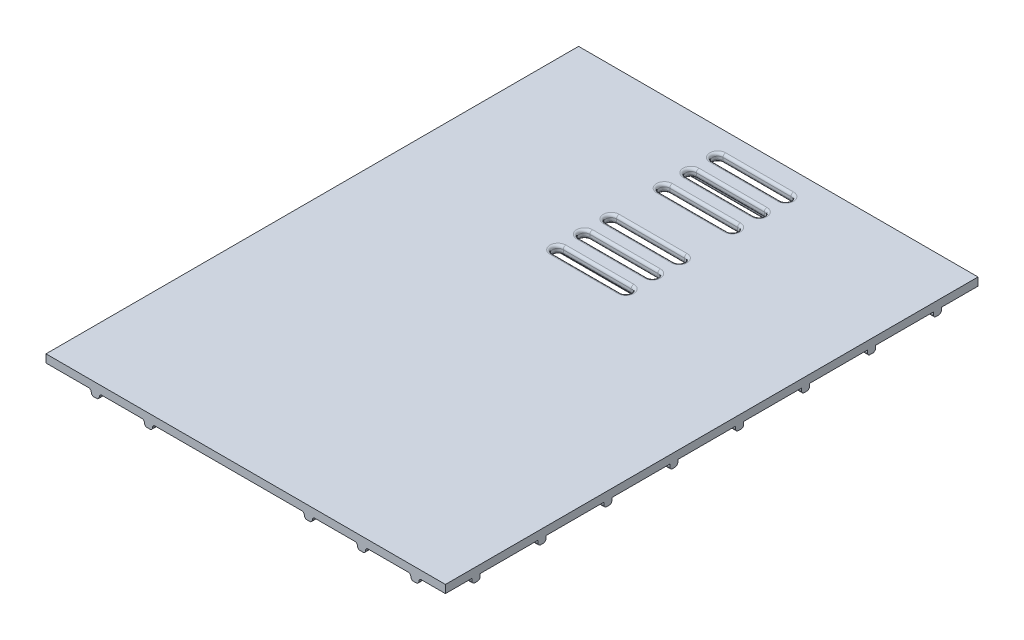
from build123d import *

# Parameters (mm, degrees)
SKETCH1_W              = 150
SKETCH1_H              = 200
BOSS_EXTRUDE1_DEPTH    = 3
BATTERYSTRAP_DEPTH     = 10
FILLET4_R              = 1
LPATTERN1_COUNT        = 3
LPATTERN1_PITCH        = 10
FILLET4_OF_LPATTERN1_R = 1
SKETCH14_W             = 3
SKETCH14_H             = 200
BOSS_EXTRUDE2_DEPTH    = 2
FILLET5_R              = 1
LPATTERN2_COUNT        = 7
LPATTERN2_PITCH        = 20
FILLET5_OF_LPATTERN2_R = 1
SKETCH15_W             = 150
SKETCH15_H             = 3
BOSS_EXTRUDE3_DEPTH    = 2
FILLET6_R              = 1
LPATTERN3_START        = -75
LPATTERN3_DEPTH        = 150


# Read off the part's stored shape, not the designer's step: LPattern3
with BuildPart() as part:
    # Sketch1 → Boss-Extrude1 (new body)
    with BuildSketch(Plane(origin=(0, 0, 0), x_dir=(1, 0, 0), z_dir=(0, 1, 0))):
        Rectangle(SKETCH1_W, SKETCH1_H)
    extrude(amount=BOSS_EXTRUDE1_DEPTH)

    # Sketch13 → BatteryStrap (cut)
    with BuildSketch(Plane(origin=(0, 3, 0), x_dir=(1, 0, 0), z_dir=(0, 1, 0))):
        with BuildLine():
            Line((-12.75, 92), (12.75, 92))
            ThreePointArc((12.75, 92), (14.75, 90), (12.75, 88))
            Line((12.75, 88), (-12.75, 88))
            ThreePointArc((-12.75, 88), (-14.75, 90), (-12.75, 92))
        make_face()
        with BuildLine():
            Line((-12.75, 52), (12.75, 52))
            ThreePointArc((12.75, 52), (14.75, 50), (12.75, 48))
            Line((12.75, 48), (-12.75, 48))
            ThreePointArc((-12.75, 48), (-14.75, 50), (-12.75, 52))
        make_face()
    batterystrap = extrude(amount=-BATTERYSTRAP_DEPTH, mode=Mode.SUBTRACT)

    # Fillet4
    fillet4_edges = [part.edges().sort_by_distance(p)[0] for p in [
        (0, 0, -48),
        (14.75, 0, -50),
        (0, 0, -52),
        (-14.75, 0, -50),
        (0, 0, -88),
        (14.75, 0, -90),
        (0, 0, -92),
        (-14.75, 0, -90),
        (-14.75, 3, -90),
        (0, 3, -88),
        (14.75, 3, -90),
        (0, 3, -92),
        (-14.75, 3, -50),
        (0, 3, -48),
        (14.75, 3, -50),
        (0, 3, -52),
    ]]
    fillet(fillet4_edges, radius=FILLET4_R)

    # LPattern1: BatteryStrap ×3
    with Locations(*[(0, 0, i * LPATTERN1_PITCH) for i in range(1, LPATTERN1_COUNT)]):
        add(batterystrap, mode=Mode.SUBTRACT)

    # Fillet4 of LPattern1
    fillet4_of_lpattern1_edges = [part.edges().sort_by_distance(p)[0] for p in [
        (0, 0, -38),
        (14.75, 0, -40),
        (0, 0, -42),
        (-14.75, 0, -40),
        (0, 0, -78),
        (14.75, 0, -80),
        (0, 0, -82),
        (-14.75, 0, -80),
        (-14.75, 3, -80),
        (0, 3, -78),
        (14.75, 3, -80),
        (0, 3, -82),
        (-14.75, 3, -40),
        (0, 3, -38),
        (14.75, 3, -40),
        (0, 3, -42),
        (0, 0, -28),
        (14.75, 0, -30),
        (0, 0, -32),
        (-14.75, 0, -30),
        (0, 0, -68),
        (14.75, 0, -70),
        (0, 0, -72),
        (-14.75, 0, -70),
        (-14.75, 3, -70),
        (0, 3, -68),
        (14.75, 3, -70),
        (0, 3, -72),
        (-14.75, 3, -30),
        (0, 3, -28),
        (14.75, 3, -30),
        (0, 3, -32),
    ]]
    fillet(fillet4_of_lpattern1_edges, radius=FILLET4_OF_LPATTERN1_R)

    # Sketch14 → Boss-Extrude2 (add)
    with BuildSketch(Plane.XZ):
        with Locations((63.5, 0)):
            Rectangle(SKETCH14_W, SKETCH14_H)
    boss_extrude2 = extrude(amount=BOSS_EXTRUDE2_DEPTH)

    # Fillet5
    fillet5_edges = [part.edges().sort_by_distance(p)[0] for p in [
        (65, 0, 0),
        (62, 0, 0),
    ]]
    fillet(fillet5_edges, radius=FILLET5_R)
    fillet5_2_edges = [part.edges().sort_by_distance(p)[0] for p in [
        (62, -2, 0),
        (65, -2, 0),
    ]]
    fillet(fillet5_2_edges, radius=FILLET5_R - 0.0001)  # a hair under: the kernel refuses the full size

    # LPattern2: Boss-Extrude2 ×7, 2 skipped
    with Locations(*[(-i * LPATTERN2_PITCH, 0, 0) for i in range(1, LPATTERN2_COUNT) if i not in (3, 4)]):
        add(boss_extrude2)

    # Fillet5 of LPattern2
    fillet5_of_lpattern2_edges = [part.edges().sort_by_distance(p)[0] for p in [
        (45, 0, 0),
        (42, 0, 0),
        (25, 0, 0),
        (22, 0, 0),
        (-35, 0, 0),
        (-38, 0, 0),
        (-55, 0, 0),
        (-58, 0, 0),
    ]]
    fillet(fillet5_of_lpattern2_edges, radius=FILLET5_OF_LPATTERN2_R)
    fillet5_of_lpattern2_2_edges = [part.edges().sort_by_distance(p)[0] for p in [
        (42, -2, 0),
        (45, -2, 0),
        (22, -2, 0),
        (25, -2, 0),
        (-38, -2, 0),
        (-35, -2, 0),
        (-58, -2, 0),
        (-55, -2, 0),
    ]]
    fillet(fillet5_of_lpattern2_2_edges, radius=FILLET5_OF_LPATTERN2_R - 0.0001)  # a hair under: the kernel refuses the full size

    # Sketch15 → Boss-Extrude3 (add)
    with BuildSketch(Plane.XZ):
        with Locations((0, 88.5)):
            Rectangle(SKETCH15_W, SKETCH15_H)
    extrude(amount=BOSS_EXTRUDE3_DEPTH)

    # Fillet6
    fillet6_edges = [part.edges().sort_by_distance(p)[0] for p in [
        (69.50005, -2, 90),
        (69.50005, -2, 87),
        (53.5, -2, 87),
        (53.5, -2, 90),
        (33.5, -2, 87),
        (33.5, -2, 90),
        (-6.5, -2, 87),
        (-6.5, -2, 90),
        (-46.5, -2, 90),
        (-46.5, -2, 87),
        (-66.00005, -2, 87),
        (-66.00005, -2, 90),
    ]]
    fillet(fillet6_edges, radius=FILLET6_R)

    # LPattern3 outline → LPattern3 (add)
    with BuildSketch(Plane.YZ.offset(LPATTERN3_START)):
        with BuildLine():
            Line((-2, -84.25), (-2, -85.25))
            ThreePointArc((-2, -85.25), (-1.707106781, -85.957106781), (-1, -86.25))
            Line((-1, -86.25), (0, -86.25))
            Line((0, -86.25), (0, -83.25))
            Line((0, -83.25), (-1, -83.25))
            ThreePointArc((-1, -83.25), (-1.707106781, -83.542893219), (-2, -84.25))
        make_face()
        with BuildLine():
            Line((-2, -59.5), (-2, -60.5))
            ThreePointArc((-2, -60.5), (-1.707106781, -61.207106781), (-1, -61.5))
            Line((-1, -61.5), (0, -61.5))
            Line((0, -61.5), (0, -58.5))
            Line((0, -58.5), (-1, -58.5))
            ThreePointArc((-1, -58.5), (-1.707106781, -58.792893219), (-2, -59.5))
        make_face()
        with BuildLine():
            Line((-2, -34.75), (-2, -35.75))
            ThreePointArc((-2, -35.75), (-1.707106781, -36.457106781), (-1, -36.75))
            Line((-1, -36.75), (0, -36.75))
            Line((0, -36.75), (0, -33.75))
            Line((0, -33.75), (-1, -33.75))
            ThreePointArc((-1, -33.75), (-1.707106781, -34.042893219), (-2, -34.75))
        make_face()
        with BuildLine():
            Line((-2, -10), (-2, -11))
            ThreePointArc((-2, -11), (-1.707106781, -11.707106781), (-1, -12))
            Line((-1, -12), (0, -12))
            Line((0, -12), (0, -9))
            Line((0, -9), (-1, -9))
            ThreePointArc((-1, -9), (-1.707106781, -9.292893219), (-2, -10))
        make_face()
        with BuildLine():
            Line((-2, 14.75), (-2, 13.75))
            ThreePointArc((-2, 13.75), (-1.707106781, 13.042893219), (-1, 12.75))
            Line((-1, 12.75), (0, 12.75))
            Line((0, 12.75), (0, 15.75))
            Line((0, 15.75), (-1, 15.75))
            ThreePointArc((-1, 15.75), (-1.707106781, 15.457106781), (-2, 14.75))
        make_face()
        with BuildLine():
            Line((-2, 39.5), (-2, 38.5))
            ThreePointArc((-2, 38.5), (-1.707106781, 37.792893219), (-1, 37.5))
            Line((-1, 37.5), (0, 37.5))
            Line((0, 37.5), (0, 40.5))
            Line((0, 40.5), (-1, 40.5))
            ThreePointArc((-1, 40.5), (-1.707106781, 40.207106781), (-2, 39.5))
        make_face()
        with BuildLine():
            Line((-2, 64.25), (-2, 63.25))
            ThreePointArc((-2, 63.25), (-1.707106781, 62.542893219), (-1, 62.25))
            Line((-1, 62.25), (0, 62.25))
            Line((0, 62.25), (0, 65.25))
            Line((0, 65.25), (-1, 65.25))
            ThreePointArc((-1, 65.25), (-1.707106781, 64.957106781), (-2, 64.25))
        make_face()
    extrude(amount=LPATTERN3_DEPTH)


solid = part.part
